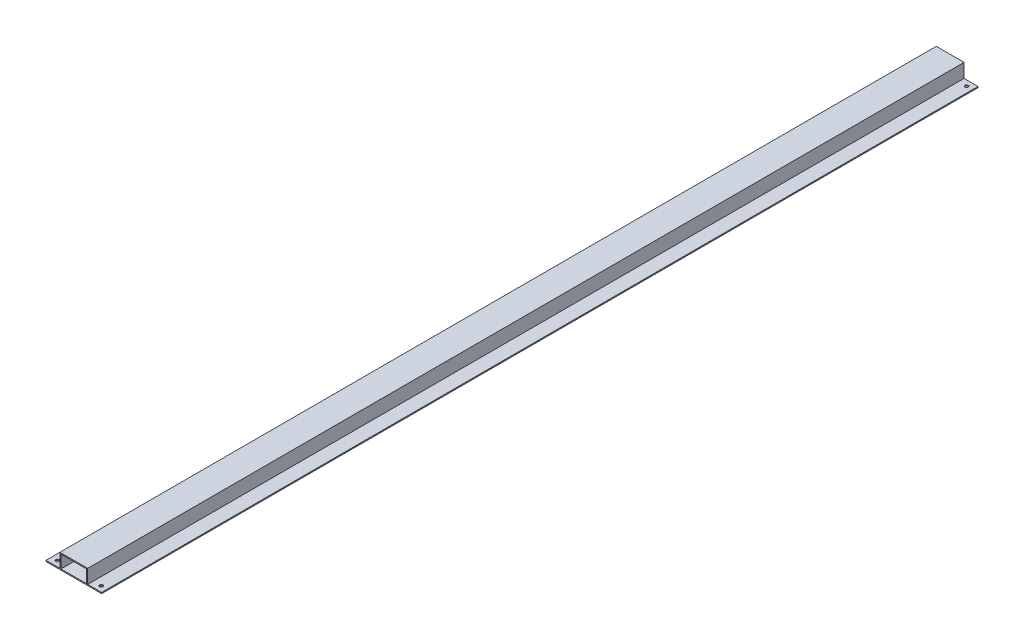
from build123d import *

# Parameters (mm, degrees)
SALIENTE_EXTRUIR1_DEPTH = 400
CROQUIS2_R              = 1.5
CORTAR_EXTRUIR1_DEPTH   = 10


with BuildPart() as part:
    # Croquis1 → Saliente-Extruir1 (new, symmetric)
    with BuildSketch(Plane.XY):
        Polygon((12.7, 13.7), (0, 13.7), (-12.7, 13.7), (-12.7, 1), (-25.4, 1), (-25.4, 0), (25.4, 0), (25.4, 1), (12.7, 1), align=None)
        Polygon((-11.7, 12.7), (0, 12.7), (11.7, 12.7), (11.7, 1), (-11.7, 1), align=None, mode=Mode.SUBTRACT)
    extrude(amount=SALIENTE_EXTRUIR1_DEPTH, both=True)

    # Croquis2 → Cortar-Extruir1 (cut)
    with BuildSketch(Plane.XZ):
        with Locations((-20, 395)):
            Circle(CROQUIS2_R)
        with Locations((20, 395)):
            Circle(CROQUIS2_R)
        with Locations((20, -395)):
            Circle(CROQUIS2_R)
        with Locations((-20, -395)):
            Circle(CROQUIS2_R)
    extrude(amount=-CORTAR_EXTRUIR1_DEPTH, mode=Mode.SUBTRACT)


solid = part.part
